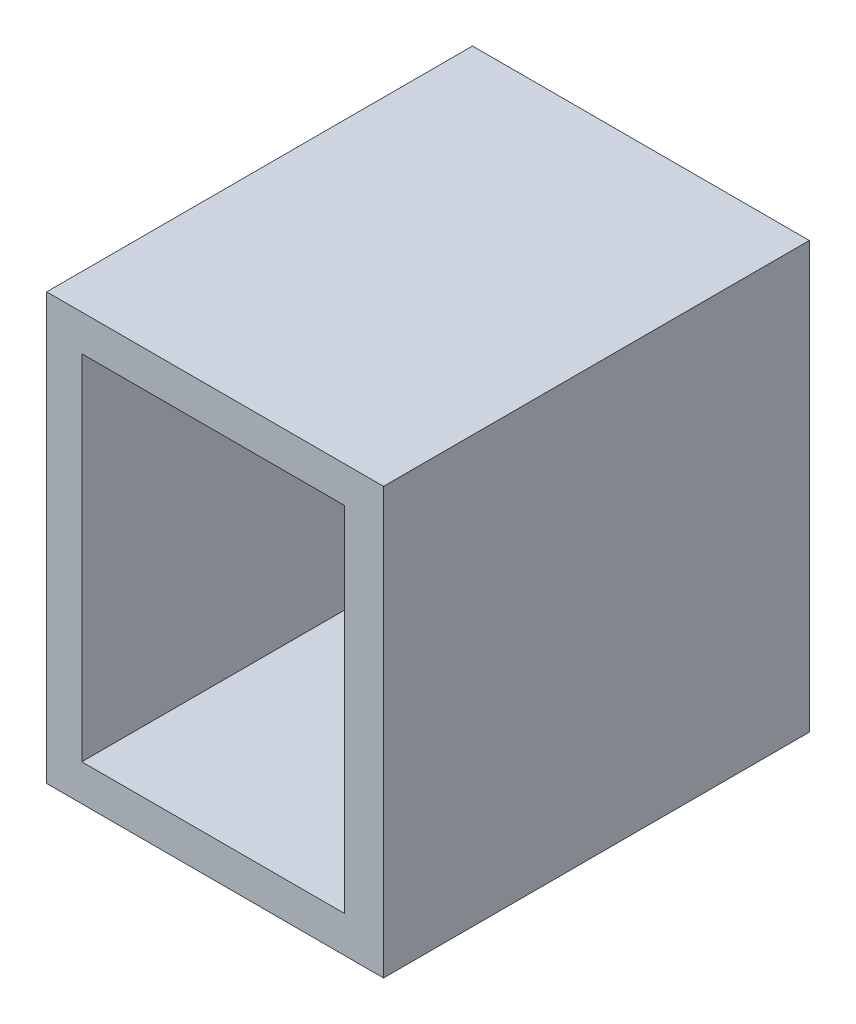
from build123d import *

# Parameters (mm, degrees)
BOSS_EXTRUDE1_DEPTH = 60


with BuildPart() as part:
    # Sketch1 → Boss-Extrude1 (new body)
    with BuildSketch(Plane.XY):
        Polygon((2.898605086, -4.744408946), (2.898605086, 25.54313099), (-44.568690096, 25.54313099), (-44.568690096, -34.45686901), (2.898605086, -34.45686901), align=None)
        Polygon((-2.611742419, 20.463258786), (-2.611742419, -4.744408946), (-2.611742419, -29.329906579), (-39.619027032, -29.329906579), (-39.619027032, 20.463258786), align=None, mode=Mode.SUBTRACT)
    extrude(amount=BOSS_EXTRUDE1_DEPTH)


solid = part.part
